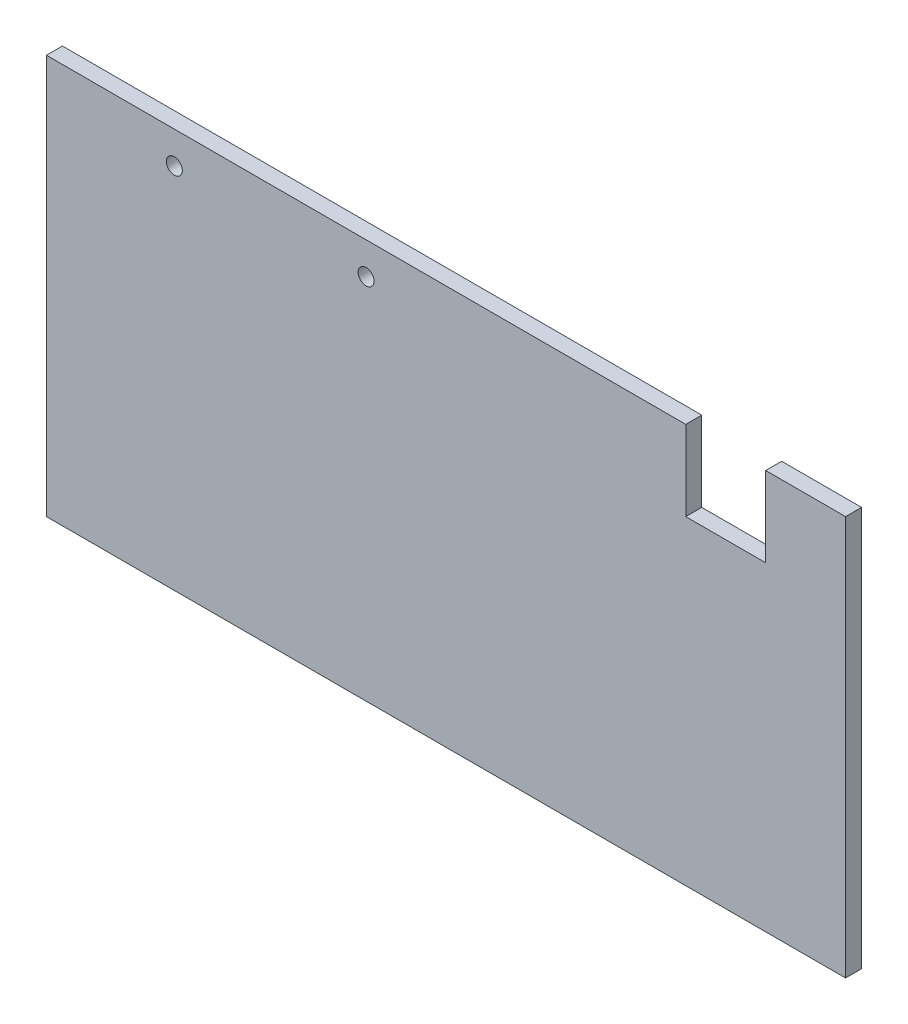
from build123d import *

# Parameters (mm, degrees)
BOSS_EXTRUDE1_DEPTH = 10
CUT_EXTRUDE1_REACH  = 281.687
SKETCH3_R           = 5


with BuildPart() as part:
    # Sketch1 → Boss-Extrude1 (new body)
    with BuildSketch(Plane.XY):
        Polygon((150, 125), (150, 75), (200, 75), (200, 125), (250, 125), (250, -125), (-250, -125), (-250, 125), align=None)
    extrude(amount=BOSS_EXTRUDE1_DEPTH)

    # Sketch3 → Cut-Extrude1 (cut, up to next)
    with BuildSketch(Plane.XY.offset(10), mode=Mode.PRIVATE) as cut_extrude1_sk1:
        with Locations((-50, 105)):
            Circle(SKETCH3_R)
    cut_extrude1_tool1 = extrude(cut_extrude1_sk1.sketch, amount=-CUT_EXTRUDE1_REACH, mode=Mode.PRIVATE) & part.part
    # Sketch3 → Cut-Extrude1 (cut, up to next)
    with BuildSketch(Plane.XY.offset(10), mode=Mode.PRIVATE) as cut_extrude1_sk2:
        with Locations((-170, 105)):
            Circle(SKETCH3_R)
    cut_extrude1_tool2 = extrude(cut_extrude1_sk2.sketch, amount=-CUT_EXTRUDE1_REACH, mode=Mode.PRIVATE) & part.part
    add(cut_extrude1_tool1.solids().sort_by_distance((-50, 105, 10))[0], mode=Mode.SUBTRACT)
    add(cut_extrude1_tool2.solids().sort_by_distance((-170, 105, 10))[0], mode=Mode.SUBTRACT)


solid = part.part
